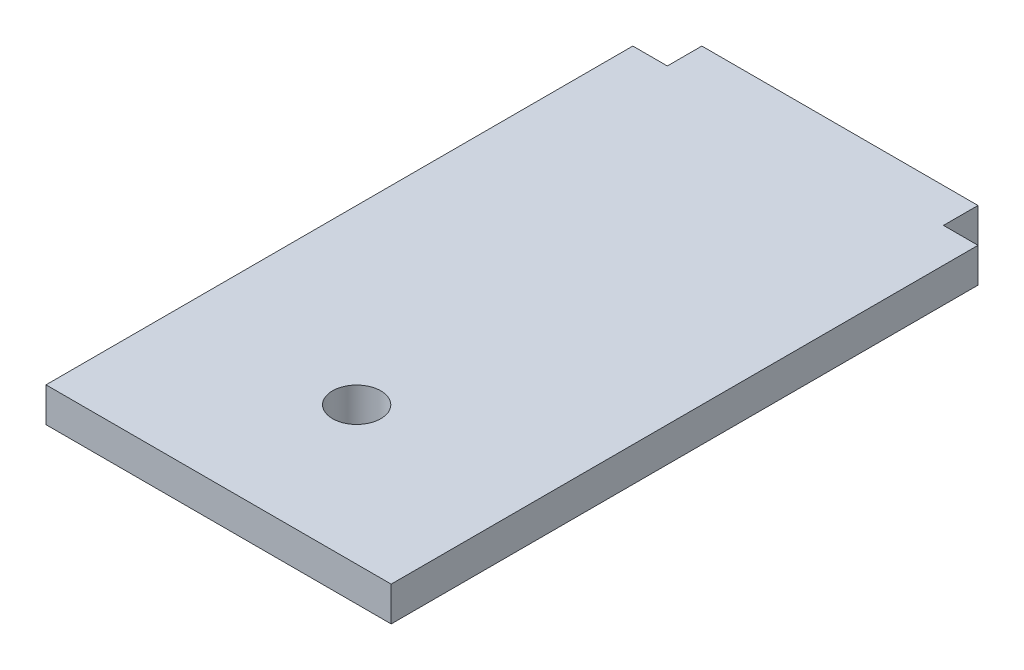
from build123d import *

# Parameters (mm, degrees)
SKETCH1_R    = 3.5
HAMMER_DEPTH = 5


with BuildPart() as part:
    # Sketch1 → Hammer (new body)
    with BuildSketch(Plane(origin=(0, 0, 0), x_dir=(1, 0, 0), z_dir=(0, 1, 0))):
        Polygon((0, 85), (5, 85), (5, 90), (45, 90), (45, 85), (50, 85), (50, 0), (0, 0), align=None)
        with Locations((25, 20)):
            Circle(SKETCH1_R, mode=Mode.SUBTRACT)
    extrude(amount=HAMMER_DEPTH)


solid = part.part
